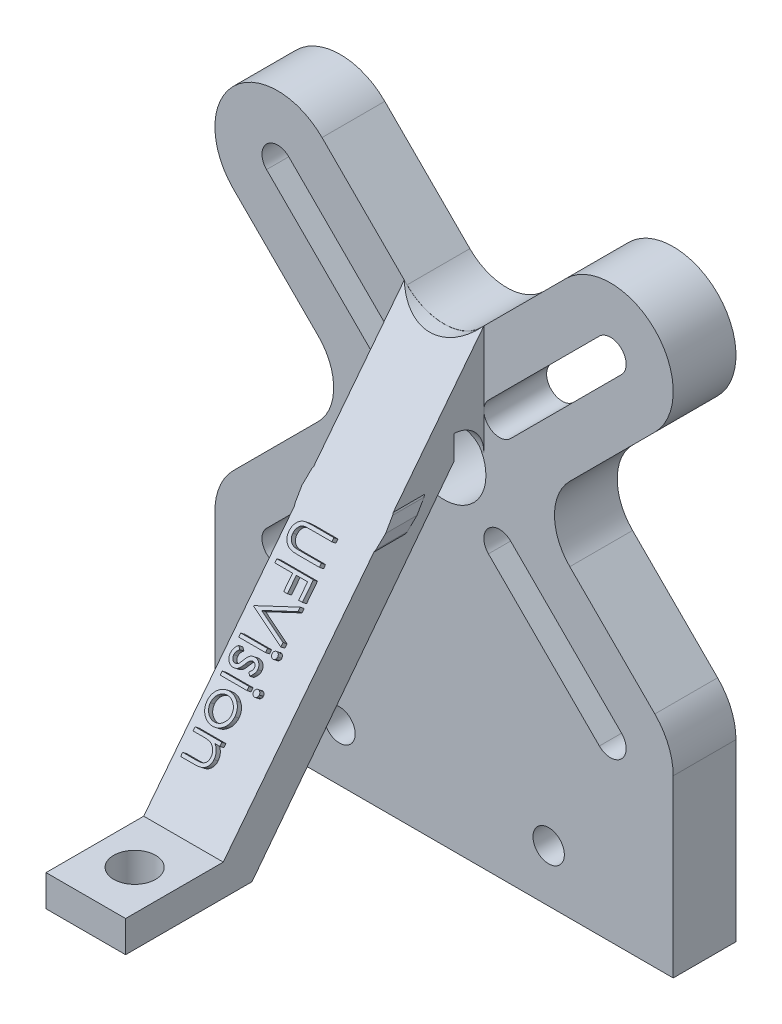
from build123d import *

# Parameters (mm, degrees)
ESBO_O1_R                  = 4
RESSALTO_EXTRUS_O1_DEPTH   = 6
ESBO_O2_R                  = 1.5
CORTE_EXTRUS_O1_DEPTH      = 6
FILETE1_R                  = 5
RESSALTO_EXTRUS_O5_DEPTH   = 50
CORTE_EXTRUS_O2_DEPTH      = 70.736657119
CORTE_EXTRUS_O2_DEPTH_BACK = 70.736657119
CORTE_EXTRUS_O5_DEPTH      = 59.418480761
CORTE_EXTRUS_O5_DEPTH_BACK = 59.418480761
RESSALTO_EXTRUS_O6_DEPTH   = 3
CORTE_EXTRUS_O6_DEPTH      = 3
CORTE_EXTRUS_O6_DEPTH_BACK = 74.114538656
ESBO_O8_R                  = 2
CORTE_EXTRUS_O7_DEPTH      = 30
ESBO_O10_W                 = 7.606601718
ESBO_O10_H                 = 7
RESSALTO_EXTRUS_O7_DEPTH   = 3
RESSALTO_EXTRUS_O8_DEPTH   = 3
ESBO_O12_R                 = 2
CORTE_EXTRUS_O8_DEPTH      = 3
RESSALTO_EXTRUS_O9_DEPTH   = 7.606601718
RESSALTO_EXTRUS_O10_DEPTH  = 7.606601718
FILETE3_R                  = 3
ESBO_O15_W                 = 2.557692307
ESBO_O15_H                 = 0.314102564
RESSALTO_EXTRUS_O11_DEPTH  = 0.5


with BuildPart() as part:
    # Esboço1 → Ressalto-extrusão1 (new body)
    with BuildSketch(Plane.XY):
        with BuildLine():
            ThreePointArc((21.909902577, -15.909902577), (21.453179772, -13.613801983), (20.152543264, -11.66726189))
            Line((20.152543264, -11.66726189), (8.485281374, 0))
            Line((8.485281374, 0), (20.152543264, 11.66726189))
            ThreePointArc((20.152543264, 11.66726189), (20.152543264, 20.152543264), (11.66726189, 20.152543264))
            Line((11.66726189, 20.152543264), (0, 8.485281374))
            Line((0, 8.485281374), (-11.66726189, 20.152543264))
            ThreePointArc((-11.66726189, 20.152543264), (-20.152543264, 20.152543264), (-20.152543264, 11.66726189))
            Line((-20.152543264, 11.66726189), (-8.485281374, 0))
            Line((-8.485281374, 0), (-20.152543264, -11.66726189))
            ThreePointArc((-20.152543264, -11.66726189), (-21.345319468, -13.368988723), (-21.886058641, -15.375525649))
            Line((-21.886058641, -15.375525649), (-21.909902577, -32.650153373))
            Line((-21.909902577, -32.650153373), (21.909902577, -32.650153373))
            Line((21.909902577, -32.650153373), (21.909902577, -15.909902577))
        make_face()
        with BuildLine():
            ThreePointArc((-14.849242405, -16.970562748), (-16.970562748, -16.970562748), (-16.970562748, -14.849242405))
            Line((-16.970562748, -14.849242405), (-6.363961031, -4.242640687))
            ThreePointArc((-6.363961031, -4.242640687), (-4.242640687, -4.242640687), (-4.242640687, -6.363961031))
            Line((-4.242640687, -6.363961031), (-14.849242405, -16.970562748))
        make_face(mode=Mode.SUBTRACT)
        Circle(ESBO_O1_R, mode=Mode.SUBTRACT)
        with BuildLine():
            Line((-6.363961031, 4.242640687), (-16.970562748, 14.849242405))
            ThreePointArc((-16.970562748, 14.849242405), (-16.970562748, 16.970562748), (-14.849242405, 16.970562748))
            Line((-14.849242405, 16.970562748), (-4.242640687, 6.363961031))
            ThreePointArc((-4.242640687, 6.363961031), (-4.242640687, 4.242640687), (-6.363961031, 4.242640687))
        make_face(mode=Mode.SUBTRACT)
        with BuildLine():
            Line((6.363961031, -4.242640687), (16.970562748, -14.849242405))
            ThreePointArc((16.970562748, -14.849242405), (16.970562748, -16.970562748), (14.849242405, -16.970562748))
            Line((14.849242405, -16.970562748), (4.242640687, -6.363961031))
            ThreePointArc((4.242640687, -6.363961031), (4.242640687, -4.242640687), (6.363961031, -4.242640687))
        make_face(mode=Mode.SUBTRACT)
        with BuildLine():
            Line((4.242640687, 6.363961031), (14.849242405, 16.970562748))
            ThreePointArc((14.849242405, 16.970562748), (16.970562748, 16.970562748), (16.970562748, 14.849242405))
            Line((16.970562748, 14.849242405), (6.363961031, 4.242640687))
            ThreePointArc((6.363961031, 4.242640687), (4.242640687, 4.242640687), (4.242640687, 6.363961031))
        make_face(mode=Mode.SUBTRACT)
    extrude(amount=RESSALTO_EXTRUS_O1_DEPTH)

    # Esboço2 → Corte-extrusão1 (cut)
    with BuildSketch(Plane.XY.offset(6)):
        with Locations((-10, -27.650158136)):
            Circle(ESBO_O2_R)
        with Locations((10, -27.650158136)):
            Circle(ESBO_O2_R)
    extrude(amount=-CORTE_EXTRUS_O1_DEPTH, mode=Mode.SUBTRACT)

    # Filete1
    filete1_edges = [part.edges().sort_by_distance(p)[0] for p in [
        (-8.485281374, 0, 3),
        (0, 8.485281374, 3),
        (8.485281374, 0, 3),
    ]]
    fillet(filete1_edges, radius=FILETE1_R)



with BuildPart() as body_2:
    # Esboço3 → Ressalto-extrusão5 (new body)
    with BuildSketch(Plane.XY.offset(6)):
        with BuildLine():
            Line((-3.803300859, 12.288582233), (-3.803300859, 1.18465053))
            Line((-3.803300859, 1.18465053), (-3.864929788, 1.030687992))
            Line((-3.864929788, 1.030687992), (-4, 0))
            Line((-4, 0), (-3.864929788, -1.030687992))
            Line((-3.864929788, -1.030687992), (-3.803300859, -1.184660399))
            Line((-3.803300859, -1.184660399), (-3.803300859, -32.650153373))
            Line((-3.803300859, -32.650153373), (3.803300859, -32.650153373))
            Line((3.803300859, -32.650153373), (3.803300859, -1.184660399))
            Line((3.803300859, -1.184660399), (3.864929788, -1.030687992))
            Line((3.864929788, -1.030687992), (4, 0))
            Line((4, 0), (3.864929788, 1.030687992))
            Line((3.864929788, 1.030687992), (3.803300859, 1.18465053))
            Line((3.803300859, 1.18465053), (3.803300859, 12.288582233))
            ThreePointArc((3.803300859, 12.288582233), (0, 10.542029862), (-3.803300859, 12.288582233))
        make_face()
    extrude(amount=RESSALTO_EXTRUS_O5_DEPTH)

    # Esboço4 → Corte-extrusão2 (cut, two sides: drawn at the far end of the back side and taken through both)
    with BuildSketch(Plane.ZY.offset(3.803300859).offset(-CORTE_EXTRUS_O2_DEPTH_BACK)):
        Polygon((6, 12.288582233), (41.055055087, -32.650153373), (56, -32.650153373), (56, 12.288582233), align=None)
    extrude(amount=CORTE_EXTRUS_O2_DEPTH + CORTE_EXTRUS_O2_DEPTH_BACK, mode=Mode.SUBTRACT)

    # Esboço6 → Corte-extrusão5 (cut, two sides: drawn at the far end of the back side and taken through both)
    with BuildSketch(Plane(origin=(3.803300859, 0, 0), x_dir=(0, 0, -1), z_dir=(1, 0, 0)).offset(-CORTE_EXTRUS_O5_DEPTH_BACK)):
        Polygon((-38.055055087, -32.650153373), (-6, 8.442740129), (-6, -32.650153373), align=None)
    extrude(amount=CORTE_EXTRUS_O5_DEPTH + CORTE_EXTRUS_O5_DEPTH_BACK, mode=Mode.SUBTRACT)

    # Esboço7 → Ressalto-extrusão6 (add)
    with BuildSketch(Plane(origin=(0, -32.650153373, 0), x_dir=(-1, 0, 0), z_dir=(0, -1, 0))):
        Polygon((3.803300859, -41.055055087), (3.803300859, -46.981406561), (-3.803300859, -46.981406561), (-3.803300859, -41.055055087), (-3.803300859, -38.055055087), (3.803300859, -38.055055087), align=None)
    extrude(amount=-RESSALTO_EXTRUS_O6_DEPTH)

    # Esboço8 → Corte-extrusão6 (cut, two sides: drawn at the far end of the back side and taken through both)
    with BuildSketch(Plane(origin=(0, -29.650153373, 0), x_dir=(1, 0, 0), z_dir=(0, 1, 0)).offset(-CORTE_EXTRUS_O6_DEPTH_BACK)):
        with Locations(Location((0, -42.848135985, 0), (0, 0, 270))):
            Circle(ESBO_O8_R)
    extrude(amount=CORTE_EXTRUS_O6_DEPTH + CORTE_EXTRUS_O6_DEPTH_BACK, mode=Mode.SUBTRACT)

    # Esboço9 → Corte-extrusão7 (cut)
    with BuildSketch(Plane.XY.offset(6)):
        Polygon((-10, -26.150158136), (-10, -22.650158136), (9.8775675, -22.650158136), (10, -26.150158136), align=None)
    extrude(amount=CORTE_EXTRUS_O7_DEPTH, mode=Mode.SUBTRACT)


with BuildPart() as body_3:
    # of the pieces the cut leaves, the one that is kept (corte_extrus_o7_keep)
    add(body_2.part.solids().sort_by_distance((-3.803300859, 12.288582233, 6))[0])



with BuildPart() as body_3_2:
    # Esboço10 → Ressalto-extrusão7 (new body)
    with BuildSketch(Plane(origin=(0, -22.650158136, 0), x_dir=(-1, 0, 0), z_dir=(0, -1, 0))):
        with Locations((0, -36.754426539)):
            Rectangle(ESBO_O10_W, ESBO_O10_H)
    extrude(amount=-RESSALTO_EXTRUS_O7_DEPTH)


with BuildPart() as body_3_1:
    add(body_3.part)

    add(body_3_2.part)  # Ressalto-extrusão8 merges body 3 2
    # Esboço11 → Ressalto-extrusão8 (add)
    with BuildSketch(Plane(origin=(0, -19.650158136, 0), x_dir=(1, 0, 0), z_dir=(0, 1, 0))):
        Polygon((-3.803300859, -33.254426539), (-3.803300859, -30.31449468), (3.803300859, -30.254426539), (3.803300859, -33.254426539), align=None)
    extrude(amount=-RESSALTO_EXTRUS_O8_DEPTH)

    # Esboço12 → Corte-extrusão8 (cut)
    with BuildSketch(Plane(origin=(0, -19.650158136, 0), x_dir=(1, 0, 0), z_dir=(0, 1, 0))):
        with Locations(Location((0, -35.584331699, 0), (0, 0, 270))):
            Circle(ESBO_O12_R)
    extrude(amount=-CORTE_EXTRUS_O8_DEPTH, mode=Mode.SUBTRACT)


with BuildPart() as part_1:
    add(part.part)

    add(body_3_1.part)  # Ressalto-extrusão9 merges body 3
    # Esboço13 → Ressalto-extrusão9 (add)
    with BuildSketch(Plane.ZY.offset(3.803300859)):
        Polygon((8.830884395, 4.813695329), (6, 4.813695329), (6, 8.442740129), align=None)
    extrude(amount=-RESSALTO_EXTRUS_O9_DEPTH)

    # Esboço14 → Ressalto-extrusão10 (add)
    with BuildSketch(Plane.ZY.offset(3.803300859)):
        Polygon((8.830884395, 4.813695329), (8.830884395, 2.539645451), (28.166316111, -22.650158136), (30.254426539, -22.650158136), align=None)
    extrude(amount=-RESSALTO_EXTRUS_O10_DEPTH)

    # Filete3
    # the kernel refuses this fillet: 3 mm, written as the material it adds along each edge
    with BuildSketch(Plane(origin=(-3.803300859, 4.813695329, 6), x_dir=(0, 0, 1), z_dir=(1, 0, 0))) as filete3_piece_1_section:
        with BuildLine():
            CenterArc((3, 2.995229526), FILETE3_R, 180, 86.768416773)
            Line((0, 2.995229526), (-0.06, 2.995229526))
            Line((-0.06, 2.995229526), (-0.06, 0))
            Line((-0.06, 0), (0, -0.06))
            ThreePointArc((0, -0.06), (1.415442198, -0.06), (2.827502083, -0.059904591))
            Line((2.827502083, -0.059904591), (2.830884395, 0))
        make_face()
    filete3_piece_1 = extrude(amount=7.606601718, mode=Mode.PRIVATE)
    filete3_piece_1 = filete3_piece_1 - Plane(origin=(0, 0, 6.767735809), x_dir=(1, 0, 0), z_dir=(0, 0, -1)) * Cylinder(4, 28, mode=Mode.PRIVATE)
    add(filete3_piece_1)

    # Esboço15 → Ressalto-extrusão11 (add)
    # profile 1 of 10: a face of its own
    with BuildSketch(Plane(origin=(0, 7.558579547, 9.689701156), x_dir=(1, 0, 0), z_dir=(0, 0.6150627933963353, 0.7884781291700468))):
        with BuildLine():
            Line((0.645377006, -11.53747187), (0.645377006, -11.851574434))
            Line((0.645377006, -11.851574434), (-1.451678283, -11.851574434))
            add(Edge.make_bspline(
                [(-1.451678283, -11.851574434), (-1.481359019, -11.85152769), (-1.53768333, -11.851438985), (-1.61785163, -11.852031499), (-1.689124089, -11.853690867), (-1.751775437, -11.854737027), (-1.805518184, -11.85706436), (-1.850643495, -11.858962407), (-1.886937697, -11.861402964), (-1.908118623, -11.864336082), (-1.917223155, -11.86559687)],
                knots=[0, 0, 0, 0, 1.528628734, 2.90083645, 4.128790002, 5.200304208, 6.127813768, 6.898992206, 7.526736466, 8, 8, 8, 8], degree=3))
            add(Edge.make_bspline(
                [(-1.917223155, -11.86559687), (-1.950072763, -11.870769303), (-2.013921021, -11.880822721), (-2.104790384, -11.906537852), (-2.186966494, -11.94216207), (-2.262088253, -11.985536537), (-2.329038836, -12.041317136), (-2.39119613, -12.10770714), (-2.444895633, -12.188893518), (-2.494298911, -12.279108972), (-2.533949372, -12.376406792), (-2.56394653, -12.475814794), (-2.582224465, -12.575858603), (-2.58434113, -12.642834659), (-2.585392225, -12.676093665)],
                knots=[0, 0, 0, 0, 1.035924841, 2.013479024, 2.933602255, 3.82183108, 4.706948133, 5.639927629, 6.646101806, 7.731477349, 8.84205456, 9.913728764, 10.963998332, 12, 12, 12, 12], degree=3))
            add(Edge.make_bspline(
                [(-2.585392225, -12.676093665), (-2.584318434, -12.704647457), (-2.582177054, -12.761590122), (-2.568914739, -12.846195781), (-2.545017548, -12.928598835), (-2.514164985, -13.00918834), (-2.473464826, -13.084780719), (-2.426123813, -13.155321876), (-2.371404466, -13.21895327), (-2.309984356, -13.276336886), (-2.241316717, -13.326578932), (-2.165608443, -13.368970224), (-2.083108409, -13.404697958), (-2.02493402, -13.422206862), (-1.995047674, -13.431201838)],
                knots=[0, 0, 0, 0, 0.994510594, 1.983277156, 2.972612928, 3.9776239, 4.982470102, 5.955333794, 6.930747147, 7.898149105, 8.876444039, 9.885893618, 10.913904934, 12, 12, 12, 12], degree=3))
            add(Edge.make_bspline(
                [(-1.995047674, -13.431201838), (-1.9826991, -13.434201963), (-1.9551815, -13.440887451), (-1.908660209, -13.447134496), (-1.853770845, -13.453641022), (-1.790119032, -13.458155592), (-1.71791806, -13.462556812), (-1.636791802, -13.465189885), (-1.547034841, -13.466406918), (-1.48439768, -13.466769598), (-1.451678283, -13.466959049)],
                knots=[0, 0, 0, 0, 0.558680831, 1.244966039, 2.062412453, 2.990489873, 4.051219941, 5.244515665, 6.560634259, 8, 8, 8, 8], degree=3))
            Line((-1.451678283, -13.466959049), (0.645377006, -13.466959049))
            Line((0.645377006, -13.466959049), (0.645377006, -13.781061613))
            Line((0.645377006, -13.781061613), (-1.468505206, -13.781061613))
            add(Edge.make_bspline(
                [(-1.468505206, -13.781061613), (-1.506603995, -13.7808103), (-1.580956098, -13.780319848), (-1.689901762, -13.775980271), (-1.793274861, -13.769261049), (-1.890943495, -13.759103043), (-1.983023975, -13.747888971), (-2.069381771, -13.731843902), (-2.150595933, -13.715070577), (-2.226527413, -13.69385425), (-2.298180859, -13.668260363), (-2.367446192, -13.638294771), (-2.433757193, -13.601627613), (-2.498071569, -13.559785372), (-2.560477426, -13.513329055), (-2.619509224, -13.459782477), (-2.677102318, -13.401917912), (-2.731356232, -13.338516466), (-2.781465475, -13.270711193), (-2.824569446, -13.198381649), (-2.862417201, -13.122984265), (-2.892313271, -13.043711472), (-2.915452955, -12.961079609), (-2.932482137, -12.875092946), (-2.942197107, -12.785459074), (-2.943637295, -12.724493686), (-2.944366584, -12.693621709)],
                knots=[0, 0, 0, 0, 1.316364231, 2.568964831, 3.766826305, 4.894964518, 5.961692026, 6.970710131, 7.928946231, 8.826316495, 9.692177228, 10.556379512, 11.43093279, 12.306715499, 13.20629939, 14.115652445, 15.057829886, 16.025681089, 16.996391533, 17.967202739, 18.931442607, 19.907779629, 20.889445314, 21.893507297, 22.933303057, 24, 24, 24, 24], degree=3))
            add(Edge.make_bspline(
                [(-2.944366584, -12.693621709), (-2.943581819, -12.659952607), (-2.942042112, -12.593893948), (-2.933219362, -12.496555881), (-2.916600968, -12.403241684), (-2.895441024, -12.312965807), (-2.866257287, -12.22695731), (-2.832159162, -12.144063866), (-2.790281902, -12.065705185), (-2.743688509, -11.990610056), (-2.691263871, -11.9207853), (-2.634123697, -11.856687897), (-2.573183319, -11.798212026), (-2.507782953, -11.74634333), (-2.438431246, -11.700222445), (-2.364932007, -11.660492232), (-2.28731369, -11.626378988), (-2.23336049, -11.608772421), (-2.206085334, -11.599871709)],
                knots=[0, 0, 0, 0, 1.13879206, 2.234305948, 3.301075583, 4.341971843, 5.366689343, 6.369221514, 7.369726634, 8.367512178, 9.355451585, 10.318319045, 11.268648973, 12.207971039, 13.137398894, 14.081662264, 15.030215811, 16, 16, 16, 16], degree=3))
            add(Edge.make_bspline(
                [(-2.206085334, -11.599871709), (-2.18745276, -11.594694551), (-2.147038291, -11.58346518), (-2.080151802, -11.571439882), (-2.003136885, -11.561330801), (-1.915988266, -11.551825242), (-1.8186384, -11.546216284), (-1.711129484, -11.541298846), (-1.593331522, -11.537437227), (-1.511277007, -11.537459999), (-1.468505206, -11.53747187)],
                knots=[0, 0, 0, 0, 0.625038921, 1.35572334, 2.194682327, 3.136881307, 4.189498639, 5.346923369, 6.617055217, 8, 8, 8, 8], degree=3))
            Line((-1.468505206, -11.53747187), (0.645377006, -11.53747187))
        make_face()
    # profile 2 of 10: a face of its own
    with BuildSketch(Plane(origin=(0, 7.558579547, 9.689701156), x_dir=(1, 0, 0), z_dir=(0, 0.6150627933963353, 0.7884781291700468))):
        Polygon((0.645377006, -14.723369306), (0.645377006, -16.428497511), (0.286402647, -16.428497511), (0.286402647, -15.03747187), (-0.79052043, -15.03747187), (-0.79052043, -16.428497511), (-1.149494789, -16.428497511), (-1.149494789, -15.03747187), (-2.854622994, -15.03747187), (-2.854622994, -14.723369306), align=None)
    # profile 3 of 10: a face of its own
    with BuildSketch(Plane(origin=(0, 7.558579547, 9.689701156), x_dir=(1, 0, 0), z_dir=(0, 0.6150627933963353, 0.7884781291700468))):
        Polygon((0.645377006, -16.78747187), (0.645377006, -17.124010331), (-2.11073277, -18.289975876), (0.645377006, -19.456642543), (0.645377006, -19.793882126), (-2.854622994, -18.313112895), (-2.854622994, -18.2682411), align=None)
    # profile 4 of 10: a face of its own
    with BuildSketch(Plane(origin=(0, 7.558579547, 9.689701156), x_dir=(1, 0, 0), z_dir=(0, 0.6150627933963353, 0.7884781291700468))):
        with BuildLine():
            add(Edge.make_bspline(
                [(0.77999239, -20.487992703), (0.779084316, -20.507480764), (0.777306132, -20.545642131), (0.762200362, -20.600881625), (0.736204589, -20.651130421), (0.702461442, -20.696365012), (0.661146323, -20.733862409), (0.614203216, -20.760750038), (0.563098336, -20.777915019), (0.527489544, -20.780000032), (0.509359377, -20.781061613)],
                knots=[0, 0, 0, 0, 1.054986045, 2.065865298, 3.074122704, 4.105114675, 5.109626121, 6.074217918, 7.019490725, 8, 8, 8, 8], degree=3))
            add(Edge.make_bspline(
                [(0.509359377, -20.781061613), (0.491699813, -20.779976284), (0.456788945, -20.777830715), (0.406570159, -20.760762727), (0.360280724, -20.733636988), (0.31904638, -20.69638997), (0.285322726, -20.65112383), (0.259321802, -20.600883369), (0.244217393, -20.545641673), (0.242439022, -20.507480609), (0.241530852, -20.487992703)],
                knots=[0, 0, 0, 0, 0.961106377, 1.899993565, 2.859409042, 3.870007927, 4.90724781, 5.921615355, 6.938620636, 8, 8, 8, 8], degree=3))
            add(Edge.make_bspline(
                [(0.241530852, -20.487992703), (0.242409855, -20.46872862), (0.244120719, -20.431233599), (0.259502513, -20.377009797), (0.285266184, -20.327569521), (0.31951307, -20.283074685), (0.360006543, -20.245089192), (0.406605124, -20.218063539), (0.456780043, -20.200949917), (0.491696823, -20.198810499), (0.509359377, -20.19772828)],
                knots=[0, 0, 0, 0, 1.055304112, 2.054011575, 3.063363921, 4.096942562, 5.122536081, 6.088009498, 7.032825006, 8, 8, 8, 8], degree=3))
            add(Edge.make_bspline(
                [(0.509359377, -20.19772828), (0.527492648, -20.198786635), (0.563107536, -20.200865311), (0.614167652, -20.218076822), (0.661422843, -20.244860991), (0.70199509, -20.283099229), (0.736261006, -20.327563096), (0.7620197, -20.37701147), (0.777402796, -20.431233155), (0.77911348, -20.468728469), (0.77999239, -20.487992703)],
                knots=[0, 0, 0, 0, 0.986662878, 1.937868148, 2.908513651, 3.927890639, 4.955204348, 5.958438607, 6.951092507, 8, 8, 8, 8], degree=3))
        make_face()
    # profile 5 of 10: a face of its own
    with BuildSketch(Plane(origin=(0, 7.558579547, 9.689701156), x_dir=(1, 0, 0), z_dir=(0, 0.6150627933963353, 0.7884781291700468))):
        with Locations((-1.575776841, -20.489394947)):
            Rectangle(ESBO_O15_W, ESBO_O15_H)
    # profile 6 of 10: a face of its own
    with BuildSketch(Plane(origin=(0, 7.558579547, 9.689701156), x_dir=(1, 0, 0), z_dir=(0, 0.6150627933963353, 0.7884781291700468))):
        with BuildLine():
            Line((-0.615941103, -22.575933408), (-0.835392225, -22.362792383))
            add(Edge.make_bspline(
                [(-0.835392225, -22.362792383), (-0.814074471, -22.344404896), (-0.772976351, -22.308955987), (-0.718100764, -22.25268425), (-0.671632731, -22.19664849), (-0.633397492, -22.141144254), (-0.603306006, -22.086067964), (-0.582052706, -22.030949371), (-0.568709962, -21.975939731), (-0.567000755, -21.939150744), (-0.566161456, -21.921085652)],
                knots=[0, 0, 0, 0, 1.265880991, 2.440469525, 3.530740057, 4.536711111, 5.468008477, 6.34654737, 7.188078389, 8, 8, 8, 8], degree=3))
            add(Edge.make_bspline(
                [(-0.566161456, -21.921085652), (-0.567246814, -21.898952447), (-0.569382644, -21.855397432), (-0.590278949, -21.793076577), (-0.623124433, -21.735626725), (-0.668781527, -21.685470867), (-0.721816016, -21.643212835), (-0.780393265, -21.611183619), (-0.844077684, -21.592427955), (-0.888089782, -21.589990283), (-0.910412257, -21.588753921)],
                knots=[0, 0, 0, 0, 1.000196853, 1.968245854, 2.94569445, 3.981000421, 5.021494845, 6.007172807, 6.989258906, 8, 8, 8, 8], degree=3))
            add(Edge.make_bspline(
                [(-0.910412257, -21.588753921), (-0.930624301, -21.589864733), (-0.970991412, -21.592083226), (-1.030539446, -21.609329906), (-1.088596484, -21.636795978), (-1.124159391, -21.662466172), (-1.142483571, -21.675693024)],
                knots=[0, 0, 0, 0, 0.960159726, 1.917612774, 2.927026955, 4, 4, 4, 4], degree=3))
            add(Edge.make_bspline(
                [(-1.142483571, -21.675693024), (-1.152268156, -21.683656517), (-1.17309341, -21.70060581), (-1.201997264, -21.732414325), (-1.233939515, -21.768436828), (-1.265876352, -21.811756766), (-1.299508077, -21.860507794), (-1.33351021, -21.915747078), (-1.370474635, -21.975721583), (-1.39391907, -22.018658889), (-1.406105366, -22.040977479)],
                knots=[0, 0, 0, 0, 0.66740084, 1.420478572, 2.27185888, 3.217733974, 4.268547843, 5.408967954, 6.65319498, 8, 8, 8, 8], degree=3))
            add(Edge.make_bspline(
                [(-1.406105366, -22.040977479), (-1.421350269, -22.068191056), (-1.450798401, -22.120758726), (-1.496508105, -22.195451493), (-1.541939529, -22.263238534), (-1.586606803, -22.324694202), (-1.631759671, -22.378636011), (-1.675667428, -22.426700563), (-1.719656736, -22.467689007), (-1.75038985, -22.490642934), (-1.765079725, -22.501614498)],
                knots=[0, 0, 0, 0, 1.27191281, 2.456916733, 3.569705269, 4.599008579, 5.553216877, 6.436649441, 7.252746552, 8, 8, 8, 8], degree=3))
            add(Edge.make_bspline(
                [(-1.765079725, -22.501614498), (-1.794713529, -22.519916303), (-1.853617814, -22.556295526), (-1.951271028, -22.593008053), (-2.053993281, -22.616473395), (-2.12462344, -22.619345708), (-2.160512418, -22.620805203)],
                knots=[0, 0, 0, 0, 0.995606783, 1.979007074, 2.973082153, 4, 4, 4, 4], degree=3))
            add(Edge.make_bspline(
                [(-2.160512418, -22.620805203), (-2.185782381, -22.62008732), (-2.235579605, -22.618672654), (-2.308902703, -22.608790892), (-2.379080391, -22.591923025), (-2.446523314, -22.568543272), (-2.511100015, -22.538562305), (-2.572324044, -22.50088109), (-2.630715389, -22.457191495), (-2.685945825, -22.407749636), (-2.736054884, -22.352836759), (-2.779649129, -22.29378862), (-2.81646717, -22.231494476), (-2.846692833, -22.165939131), (-2.870771901, -22.096983253), (-2.887431461, -22.024569826), (-2.897405031, -21.948941654), (-2.898789396, -21.897511765), (-2.899494789, -21.871306004)],
                knots=[0, 0, 0, 0, 1.032633728, 2.034917567, 3.017159222, 3.977707287, 4.947659047, 5.920662675, 6.910168127, 7.92466491, 8.94557085, 9.942744688, 10.919024275, 11.897637117, 12.88838639, 13.898512555, 14.929200919, 16, 16, 16, 16], degree=3))
            add(Edge.make_bspline(
                [(-2.899494789, -21.871306004), (-2.898502089, -21.835938829), (-2.896530482, -21.765695902), (-2.878024421, -21.661806183), (-2.849229027, -21.560285424), (-2.809513093, -21.461901884), (-2.75936238, -21.36885577), (-2.699299986, -21.283724845), (-2.631309989, -21.206213383), (-2.579197078, -21.162095109), (-2.553140623, -21.140035972)],
                knots=[0, 0, 0, 0, 1.013940152, 2.01379169, 3.017749504, 4.037548394, 5.051665909, 6.043208538, 7.021604269, 8, 8, 8, 8], degree=3))
            Line((-2.553140623, -21.140035972), (-2.316161456, -21.348269145))
            add(Edge.make_bspline(
                [(-2.316161456, -21.348269145), (-2.337516221, -21.368041558), (-2.378915661, -21.406373371), (-2.434040001, -21.467674587), (-2.480241272, -21.530053988), (-2.518884687, -21.592888675), (-2.54866009, -21.657108769), (-2.569578684, -21.722354384), (-2.583022876, -21.788492808), (-2.584601159, -21.832914943), (-2.585392225, -21.855180203)],
                knots=[0, 0, 0, 0, 1.179806542, 2.287233372, 3.337373186, 4.324005949, 5.273901747, 6.200048787, 7.097828587, 8, 8, 8, 8], degree=3))
            add(Edge.make_bspline(
                [(-2.585392225, -21.855180203), (-2.5840214, -21.885498129), (-2.581343039, -21.944734271), (-2.557025947, -22.029578029), (-2.518895995, -22.107916656), (-2.464811297, -22.175940001), (-2.401855724, -22.233842162), (-2.330941605, -22.275770337), (-2.254150148, -22.302046512), (-2.200917845, -22.305132511), (-2.173833732, -22.306702639)],
                knots=[0, 0, 0, 0, 1.072336372, 2.095165389, 3.102688358, 4.141489647, 5.156069229, 6.117746104, 7.042326257, 8, 8, 8, 8], degree=3))
            add(Edge.make_bspline(
                [(-2.173833732, -22.306702639), (-2.151524113, -22.305616345), (-2.107476757, -22.303471602), (-2.043726416, -22.28662833), (-1.983257136, -22.260015478), (-1.947867488, -22.233810829), (-1.929843347, -22.220464658)],
                knots=[0, 0, 0, 0, 1.013901739, 2.00181326, 2.98231254, 4, 4, 4, 4], degree=3))
            add(Edge.make_bspline(
                [(-1.929843347, -22.220464658), (-1.920807985, -22.212442264), (-1.901125703, -22.194966591), (-1.872700624, -22.16291135), (-1.842062525, -22.124529488), (-1.809730936, -22.079389325), (-1.776132331, -22.027399863), (-1.741442978, -21.968350388), (-1.704015253, -21.903049835), (-1.679195597, -21.856879204), (-1.666221552, -21.832744306)],
                knots=[0, 0, 0, 0, 0.615000592, 1.339693406, 2.178160186, 3.116406724, 4.166410947, 5.330106347, 6.604359322, 8, 8, 8, 8], degree=3))
            add(Edge.make_bspline(
                [(-1.666221552, -21.832744306), (-1.651682421, -21.806697666), (-1.623486404, -21.756184918), (-1.579570324, -21.684637627), (-1.534903049, -21.620090273), (-1.49199021, -21.560989698), (-1.448569266, -21.508828693), (-1.404592015, -21.463812744), (-1.361832029, -21.424169529), (-1.331534732, -21.402222117), (-1.317062898, -21.391738697)],
                knots=[0, 0, 0, 0, 1.262093308, 2.447601706, 3.550203992, 4.582594899, 5.537233252, 6.418365656, 7.244515135, 8, 8, 8, 8], degree=3))
            add(Edge.make_bspline(
                [(-1.317062898, -21.391738697), (-1.287917283, -21.373608097), (-1.229615868, -21.337340562), (-1.132305391, -21.302125371), (-1.029860334, -21.277919342), (-0.95917348, -21.275756952), (-0.92303245, -21.274651357)],
                knots=[0, 0, 0, 0, 0.985009483, 1.970363186, 2.962279964, 4, 4, 4, 4], degree=3))
            add(Edge.make_bspline(
                [(-0.92303245, -21.274651357), (-0.899407106, -21.27518563), (-0.85316896, -21.276231277), (-0.785229381, -21.284574239), (-0.720683995, -21.299769924), (-0.658547108, -21.318810452), (-0.600081695, -21.345346135), (-0.544168827, -21.376862056), (-0.49185383, -21.414893642), (-0.442875289, -21.457641658), (-0.397924075, -21.504113614), (-0.359379745, -21.555011396), (-0.326233729, -21.608513444), (-0.298479132, -21.664931507), (-0.27747488, -21.724749361), (-0.263018281, -21.787564464), (-0.253362863, -21.853245423), (-0.252499809, -21.898146576), (-0.252058892, -21.921085652)],
                knots=[0, 0, 0, 0, 1.087761869, 2.12890409, 3.144425528, 4.138218063, 5.116152125, 6.094559764, 7.089109474, 8.088306095, 9.085414286, 10.060442677, 11.0220762, 11.979848209, 12.949875201, 13.933947973, 14.944496518, 16, 16, 16, 16], degree=3))
            add(Edge.make_bspline(
                [(-0.252058892, -21.921085652), (-0.253160647, -21.94827905), (-0.255384826, -22.003175965), (-0.273130842, -22.085509776), (-0.302030639, -22.167629036), (-0.34288228, -22.24961791), (-0.394264121, -22.331825707), (-0.457508165, -22.41388394), (-0.530829199, -22.497125802), (-0.586936565, -22.549077256), (-0.615941103, -22.575933408)],
                knots=[0, 0, 0, 0, 0.845753203, 1.707371858, 2.609134499, 3.549244224, 4.552329203, 5.621587647, 6.770486714, 8, 8, 8, 8], degree=3))
        make_face()
    # profile 7 of 10: a face of its own
    with BuildSketch(Plane(origin=(0, 7.558579547, 9.689701156), x_dir=(1, 0, 0), z_dir=(0, 0.6150627933963353, 0.7884781291700468))):
        with BuildLine():
            add(Edge.make_bspline(
                [(0.77999239, -23.359787575), (0.779084316, -23.379275636), (0.777306132, -23.417437003), (0.762200362, -23.472676497), (0.736204589, -23.522925293), (0.702461442, -23.568159884), (0.661146323, -23.605657281), (0.614203216, -23.63254491), (0.563098336, -23.649709891), (0.527489544, -23.651794904), (0.509359377, -23.652856485)],
                knots=[0, 0, 0, 0, 1.054986045, 2.065865298, 3.074122704, 4.105114675, 5.109626121, 6.074217918, 7.019490725, 8, 8, 8, 8], degree=3))
            add(Edge.make_bspline(
                [(0.509359377, -23.652856485), (0.491699813, -23.651771155), (0.456788945, -23.649625587), (0.406570159, -23.632557599), (0.360280724, -23.60543186), (0.31904638, -23.568184842), (0.285322726, -23.522918701), (0.259321802, -23.47267824), (0.244217393, -23.417436545), (0.242439022, -23.379275481), (0.241530852, -23.359787575)],
                knots=[0, 0, 0, 0, 0.961106377, 1.899993565, 2.859409042, 3.870007927, 4.90724781, 5.921615355, 6.938620636, 8, 8, 8, 8], degree=3))
            add(Edge.make_bspline(
                [(0.241530852, -23.359787575), (0.242409855, -23.340523492), (0.244120719, -23.30302847), (0.259502513, -23.248804669), (0.285266184, -23.199364393), (0.31951307, -23.154869557), (0.360006543, -23.116884064), (0.406605124, -23.089858411), (0.456780043, -23.072744789), (0.491696823, -23.070605371), (0.509359377, -23.069523152)],
                knots=[0, 0, 0, 0, 1.055304112, 2.054011575, 3.063363921, 4.096942562, 5.122536081, 6.088009498, 7.032825006, 8, 8, 8, 8], degree=3))
            add(Edge.make_bspline(
                [(0.509359377, -23.069523152), (0.527492648, -23.070581507), (0.563107536, -23.072660182), (0.614167652, -23.089871694), (0.661422843, -23.116655862), (0.70199509, -23.154894101), (0.736261006, -23.199357968), (0.7620197, -23.248806342), (0.777402796, -23.303028026), (0.77911348, -23.340523341), (0.77999239, -23.359787575)],
                knots=[0, 0, 0, 0, 0.986662878, 1.937868148, 2.908513651, 3.927890639, 4.955204348, 5.958438607, 6.951092507, 8, 8, 8, 8], degree=3))
        make_face()
    # profile 8 of 10: a face of its own
    with BuildSketch(Plane(origin=(0, 7.558579547, 9.689701156), x_dir=(1, 0, 0), z_dir=(0, 0.6150627933963353, 0.7884781291700468))):
        with Locations((-1.575776841, -23.361189818)):
            Rectangle(ESBO_O15_W, ESBO_O15_H)
    # profile 9 of 10: a face of its own
    with BuildSketch(Plane(origin=(0, 7.558579547, 9.689701156), x_dir=(1, 0, 0), z_dir=(0, 0.6150627933963353, 0.7884781291700468))):
        with BuildLine():
            add(Edge.make_bspline(
                [(-0.252058892, -25.471566421), (-0.253077784, -25.519558885), (-0.255075583, -25.613660379), (-0.276533015, -25.751451395), (-0.30907184, -25.882845122), (-0.354874469, -26.0084052), (-0.414969307, -26.127092994), (-0.48764185, -26.239968191), (-0.573383766, -26.346804639), (-0.639747421, -26.410824998), (-0.673433091, -26.443321229)],
                knots=[0, 0, 0, 0, 1.054042676, 2.066720093, 3.05716247, 4.025731183, 4.997454851, 5.974904663, 6.97207755, 8, 8, 8, 8], degree=3))
            add(Edge.make_bspline(
                [(-0.673433091, -26.443321229), (-0.705647076, -26.471303183), (-0.769451619, -26.526725563), (-0.872907232, -26.597791282), (-0.980047332, -26.659012842), (-1.092294659, -26.708075803), (-1.20866933, -26.746760827), (-1.329571341, -26.774226523), (-1.454733688, -26.790563458), (-1.539737526, -26.792766425), (-1.582788059, -26.793882126)],
                knots=[0, 0, 0, 0, 1.025258237, 2.030674902, 3.01204498, 3.988269485, 4.97094183, 5.956517959, 6.965070386, 8, 8, 8, 8], degree=3))
            add(Edge.make_bspline(
                [(-1.582788059, -26.793882126), (-1.626088116, -26.792900789), (-1.71165105, -26.790961621), (-1.837670415, -26.772618004), (-1.959865241, -26.744086919), (-2.077723921, -26.703255075), (-2.191606799, -26.650896989), (-2.301016156, -26.587006214), (-2.40616903, -26.511134932), (-2.506167999, -26.425129636), (-2.598344915, -26.330082606), (-2.678634429, -26.226948909), (-2.747710947, -26.11768053), (-2.802576909, -26.000785848), (-2.846802696, -25.877928822), (-2.877299222, -25.748328004), (-2.895902931, -25.612099009), (-2.898280662, -25.519069552), (-2.899494789, -25.471566421)],
                knots=[0, 0, 0, 0, 0.998669827, 1.973418153, 2.932281609, 3.89081133, 4.846438734, 5.82045571, 6.809776312, 7.834649874, 8.860672198, 9.859676908, 10.845817165, 11.837296335, 12.833502054, 13.853824644, 14.904110009, 16, 16, 16, 16], degree=3))
            add(Edge.make_bspline(
                [(-2.899494789, -25.471566421), (-2.898270616, -25.423832837), (-2.89587301, -25.330344201), (-2.877437607, -25.193602247), (-2.846476853, -25.063455769), (-2.803124415, -24.9400176), (-2.747260295, -24.823123392), (-2.6789032, -24.713451538), (-2.598304258, -24.610269195), (-2.506179015, -24.515192366), (-2.406166191, -24.429195059), (-2.301016893, -24.353321716), (-2.191606607, -24.289431477), (-2.077723972, -24.23707325), (-1.959865227, -24.196241443), (-1.837670418, -24.167710349), (-1.711651049, -24.149366735), (-1.626088116, -24.147427566), (-1.582788059, -24.146446229)],
                knots=[0, 0, 0, 0, 1.099861214, 2.154133753, 3.1731438, 4.178222029, 5.163564916, 6.153006591, 7.15072618, 8.175428628, 9.198983792, 10.187031731, 11.15979573, 12.114193814, 13.071490482, 14.029120454, 15.002614863, 16, 16, 16, 16], degree=3))
            add(Edge.make_bspline(
                [(-1.582788059, -24.146446229), (-1.539971513, -24.147569539), (-1.45520211, -24.1497935), (-1.33027505, -24.16611401), (-1.209577661, -24.193472566), (-1.093652185, -24.232203962), (-0.981896749, -24.281719153), (-0.874491918, -24.342080441), (-0.771504117, -24.413871074), (-0.707782037, -24.469073025), (-0.675536456, -24.497007126)],
                knots=[0, 0, 0, 0, 1.031353054, 2.041901799, 3.029428768, 4.008703097, 4.981709435, 5.96992636, 6.972712378, 8, 8, 8, 8], degree=3))
            add(Edge.make_bspline(
                [(-0.675536456, -24.497007126), (-0.641564331, -24.529457054), (-0.574752168, -24.593275547), (-0.489179425, -24.700605168), (-0.415527082, -24.812994814), (-0.355462487, -24.932448185), (-0.309154945, -25.058357392), (-0.276381146, -25.190727664), (-0.255170495, -25.329020212), (-0.25310643, -25.423577485), (-0.252058892, -25.471566421)],
                knots=[0, 0, 0, 0, 1.027951202, 2.021646915, 2.998468564, 3.9668038, 4.943370589, 5.93035926, 6.949632805, 8, 8, 8, 8], degree=3))
        make_face()
        with BuildLine():
            add(Edge.make_bspline(
                [(-0.566161456, -25.470164177), (-0.5671261, -25.436226604), (-0.569030485, -25.369227551), (-0.583513638, -25.270607416), (-0.606463924, -25.175669296), (-0.639057721, -25.084220954), (-0.68119535, -24.996616083), (-0.732659097, -24.912758292), (-0.793723063, -24.832872876), (-0.863173545, -24.757573528), (-0.938608948, -24.68765613), (-1.019725051, -24.627241993), (-1.104194793, -24.575775879), (-1.192456633, -24.532946508), (-1.285346454, -24.501036415), (-1.381827789, -24.477864181), (-1.482093016, -24.463393727), (-1.55025406, -24.461507378), (-1.584891424, -24.460548793)],
                knots=[0, 0, 0, 0, 1.021589593, 2.016807015, 2.994807536, 3.958602519, 4.934347097, 5.916793557, 6.916107818, 7.957073844, 8.998039869, 10.008589932, 10.997041759, 11.972786337, 12.956492182, 13.948170289, 14.957322718, 16, 16, 16, 16], degree=3))
            add(Edge.make_bspline(
                [(-1.584891424, -24.460548793), (-1.629645429, -24.462151376), (-1.71847376, -24.465332205), (-1.849255801, -24.491329791), (-1.975046274, -24.534512993), (-2.094330626, -24.594059735), (-2.204888155, -24.66739334), (-2.304302006, -24.753141951), (-2.388738383, -24.852491073), (-2.459750798, -24.962057676), (-2.515673008, -25.080289064), (-2.555776668, -25.205203036), (-2.581495488, -25.335662212), (-2.584081945, -25.424937808), (-2.585392225, -25.470164177)],
                knots=[0, 0, 0, 0, 1.016977094, 2.018509362, 3.018404954, 4.033172147, 5.041280572, 6.028085189, 7.007940189, 7.995502847, 8.989109012, 9.972200833, 10.97273166, 12, 12, 12, 12], degree=3))
            add(Edge.make_bspline(
                [(-2.585392225, -25.470164177), (-2.584089535, -25.515393148), (-2.581518061, -25.604673879), (-2.555646368, -25.735314573), (-2.515847393, -25.860570894), (-2.459687637, -25.978925212), (-2.389006791, -26.088541712), (-2.30382098, -26.187181413), (-2.205149495, -26.273668479), (-2.094477217, -26.347074698), (-1.974860831, -26.405661978), (-1.849278979, -26.449048257), (-1.718467857, -26.474983494), (-1.629643451, -26.478172738), (-1.584891424, -26.479779562)],
                knots=[0, 0, 0, 0, 1.027082318, 2.027431966, 3.015401697, 4.008827937, 4.996211763, 5.971861488, 6.96198607, 7.969911943, 8.982141629, 9.981856156, 10.983207064, 12, 12, 12, 12], degree=3))
            add(Edge.make_bspline(
                [(-1.584891424, -26.479779562), (-1.550251294, -26.478828109), (-1.482084807, -26.476955795), (-1.381859167, -26.462383255), (-1.285155627, -26.439570979), (-1.192830974, -26.406263534), (-1.103763717, -26.364904092), (-1.0199787, -26.312186005), (-0.938557381, -26.252053265), (-0.863219013, -26.18200757), (-0.793469307, -26.106716699), (-0.732881539, -26.02623114), (-0.681165961, -25.942334403), (-0.639052532, -25.854701847), (-0.606589379, -25.763460449), (-0.583413663, -25.668810566), (-0.569083292, -25.570627168), (-0.567141631, -25.503866022), (-0.566161456, -25.470164177)],
                knots=[0, 0, 0, 0, 1.043020522, 2.052505155, 3.044509714, 4.030878336, 5.003918577, 5.996372628, 7.007255355, 8.048564058, 9.08987276, 10.095126797, 11.077896669, 12.053962454, 13.01807471, 13.98956039, 14.985105429, 16, 16, 16, 16], degree=3))
        make_face(mode=Mode.SUBTRACT)
    # profile 10 of 10: a face of its own
    with BuildSketch(Plane(origin=(0, 7.558579547, 9.689701156), x_dir=(1, 0, 0), z_dir=(0, 0.6150627933963353, 0.7884781291700468))):
        with BuildLine():
            Line((-0.296930687, -27.422087254), (-0.296930687, -27.736189818))
            Line((-0.296930687, -27.736189818), (-0.758268828, -27.736189818))
            add(Edge.make_bspline(
                [(-0.758268828, -27.736189818), (-0.716426105, -27.769727454), (-0.635228841, -27.834808405), (-0.528508267, -27.943192738), (-0.440563042, -28.057736638), (-0.370459248, -28.177738642), (-0.317612622, -28.303361652), (-0.279446691, -28.433839922), (-0.256561862, -28.569954628), (-0.253571632, -28.662519065), (-0.252058892, -28.70934687)],
                knots=[0, 0, 0, 0, 1.12780773, 2.188550248, 3.19190651, 4.159438251, 5.104880172, 6.052711206, 7.014878035, 8, 8, 8, 8], degree=3))
            add(Edge.make_bspline(
                [(-0.252058892, -28.70934687), (-0.253806684, -28.756676225), (-0.257227534, -28.84931119), (-0.284207626, -28.984207278), (-0.330558751, -29.11030793), (-0.393409827, -29.227336905), (-0.471990054, -29.332604906), (-0.564027708, -29.424216644), (-0.669081836, -29.500634535), (-0.766841691, -29.551794218), (-0.853525215, -29.585525277), (-0.9277732, -29.606756347), (-1.010490974, -29.624787715), (-1.101430679, -29.640419345), (-1.201228834, -29.650996493), (-1.309476536, -29.659338773), (-1.426138664, -29.665317471), (-1.506825292, -29.665554677), (-1.548433091, -29.665676998)],
                knots=[0, 0, 0, 0, 1.235764744, 2.418689688, 3.575570385, 4.733739044, 5.876600945, 6.994686206, 8.113221397, 9.257403329, 9.866223892, 10.540462211, 11.272173464, 12.077110251, 12.949508505, 13.892531187, 14.913238277, 16, 16, 16, 16], degree=3))
            Line((-1.548433091, -29.665676998), (-2.854622994, -29.665676998))
            Line((-2.854622994, -29.665676998), (-2.854622994, -29.351574434))
            Line((-2.854622994, -29.351574434), (-1.651497994, -29.351574434))
            add(Edge.make_bspline(
                [(-1.651497994, -29.351574434), (-1.61667555, -29.351381226), (-1.550066139, -29.351011652), (-1.454697116, -29.349846005), (-1.368210537, -29.347036198), (-1.29081317, -29.343087886), (-1.222579333, -29.337308855), (-1.163370056, -29.331286224), (-1.113260514, -29.323921247), (-1.083095432, -29.317358334), (-1.069566905, -29.314414979)],
                knots=[0, 0, 0, 0, 1.430800155, 2.736877192, 3.918605307, 4.986035426, 5.920637409, 6.731861385, 7.431261377, 8, 8, 8, 8], degree=3))
            add(Edge.make_bspline(
                [(-1.069566905, -29.314414979), (-1.02985572, -29.303789447), (-0.953423975, -29.283338586), (-0.849749623, -29.232804603), (-0.761551435, -29.168990423), (-0.689374713, -29.091092573), (-0.633203876, -28.999863498), (-0.594229922, -28.895556355), (-0.569853652, -28.779177714), (-0.56742652, -28.697323331), (-0.566161456, -28.65465937)],
                knots=[0, 0, 0, 0, 1.084156227, 2.086665306, 3.027808233, 3.945421172, 4.874247719, 5.839848303, 6.874090471, 8, 8, 8, 8], degree=3))
            add(Edge.make_bspline(
                [(-0.566161456, -28.65465937), (-0.566637283, -28.629391598), (-0.567578934, -28.579387329), (-0.577032816, -28.505238648), (-0.592481595, -28.433309644), (-0.613385912, -28.362907246), (-0.641832282, -28.295524876), (-0.674759341, -28.229193443), (-0.71507968, -28.165811233), (-0.760259172, -28.104179467), (-0.810610527, -28.046908142), (-0.862962736, -27.992855186), (-0.919519842, -27.945363827), (-0.97827911, -27.902254718), (-1.040421697, -27.865087139), (-1.105283124, -27.832631188), (-1.172966043, -27.805096259), (-1.219941001, -27.791413464), (-1.24344511, -27.784567222)],
                knots=[0, 0, 0, 0, 1.02388931, 2.02625049, 3.024079426, 4.004119353, 4.998163158, 5.985366248, 7.002659681, 8.039138713, 9.080111048, 10.09169763, 11.086418407, 12.069932368, 13.043171485, 14.017654831, 15.008125612, 16, 16, 16, 16], degree=3))
            add(Edge.make_bspline(
                [(-1.24344511, -27.784567222), (-1.260700313, -27.780627574), (-1.298263987, -27.772051165), (-1.359908407, -27.762787985), (-1.431218382, -27.75438041), (-1.512110699, -27.747343451), (-1.602868574, -27.743038034), (-1.703104412, -27.738343638), (-1.8132179, -27.736634577), (-1.889879593, -27.736342223), (-1.929843347, -27.736189818)],
                knots=[0, 0, 0, 0, 0.615963638, 1.340920617, 2.168419149, 3.115676021, 4.16674242, 5.331190069, 6.6087489, 8, 8, 8, 8], degree=3))
            Line((-1.929843347, -27.736189818), (-2.854622994, -27.736189818))
            Line((-2.854622994, -27.736189818), (-2.854622994, -27.422087254))
            Line((-2.854622994, -27.422087254), (-0.296930687, -27.422087254))
        make_face()
    extrude(amount=RESSALTO_EXTRUS_O11_DEPTH)


solid = part_1.part
